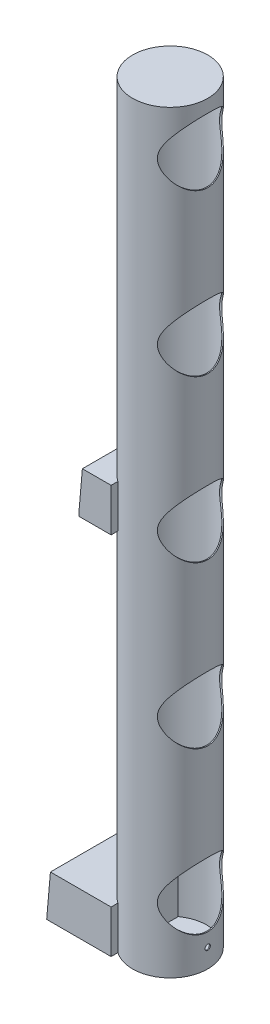
from build123d import *

# Parameters (mm, degrees)
SKETCH_2_R               = 35
SKETCH_2_R_2             = 34
EXTRUDE_1_DEPTH          = 700
EXTRUDE_START            = 1
SKETCH_3_R               = 35
EXTRUDE_2_DEPTH          = 1
SKETCH_4_R               = 35
EXTRUDE_3_DEPTH          = 1
SKETCH_5_R               = 2.5
SKETCH_5_R_2             = 30
CUT_EXTRUDE_1_DEPTH      = 703.745330828
SKETCH_6_R               = 10
CUT_EXTRUDE_2_DEPTH      = 703.745330937
EXTRUDE_START_2          = -20
SKETCH_7_W               = 70
SKETCH_7_H               = 40
EXTRUDE_4_DEPTH          = 60
EXTRUDE_START_3          = -50
SKETCH_8_W               = 70
SKETCH_8_H               = 40
EXTRUDE_5_DEPTH          = 30
CUT_EXTRUDE_3_DEPTH      = 707.417723551
CUT_EXTRUDE_3_DEPTH_BACK = 707.417723551


with BuildPart() as part:
    # Эскиз2 → Бобышка-Вытянуть1 (new body)
    with BuildSketch(Plane(origin=(0, 0, 0), x_dir=(1, 0, 0), z_dir=(0, 1, 0))):
        Circle(SKETCH_2_R)
        Circle(SKETCH_2_R_2, mode=Mode.SUBTRACT)
    extrude(amount=EXTRUDE_1_DEPTH)

    # Эскиз3 → Бобышка-Вытянуть2 (add)
    with BuildSketch(Plane.XZ.offset(EXTRUDE_START)):
        Circle(SKETCH_3_R)
    extrude(amount=-EXTRUDE_2_DEPTH)

    # Эскиз4 → Бобышка-Вытянуть3 (add)
    with BuildSketch(Plane(origin=(0, 700, 0), x_dir=(1, 0, 0), z_dir=(0, 1, 0))):
        Circle(SKETCH_4_R)
    extrude(amount=EXTRUDE_3_DEPTH)

    # Эскиз5 → Вырез-Вытянуть1 (cut, through all)
    with BuildSketch(Plane(origin=(0, 0, 0), x_dir=(0, 0, -1), z_dir=(1, 0, 0))):
        with Locations((0, 16.5)):
            Circle(SKETCH_5_R)
        with Locations((0, 59)):
            Circle(SKETCH_5_R_2)
        with Locations((0, 209)):
            Circle(SKETCH_5_R_2)
        with Locations((0, 359)):
            Circle(SKETCH_5_R_2)
        with Locations((0, 509)):
            Circle(SKETCH_5_R_2)
        with Locations((0, 659)):
            Circle(SKETCH_5_R_2)
    extrude(amount=CUT_EXTRUDE_1_DEPTH, mode=Mode.SUBTRACT)

    # Эскиз6 → Вырез-Вытянуть2 (cut, through all)
    with BuildSketch(Plane(origin=(0, 0, 0), x_dir=(0, 0, -1), z_dir=(1, 0, 0))):
        with Locations((0, 686)):
            Circle(SKETCH_6_R)
    extrude(amount=-CUT_EXTRUDE_2_DEPTH, mode=Mode.SUBTRACT)

    # Эскиз7 → Бобышка-Вытянуть4 (add)
    with BuildSketch(Plane(origin=(0, 0, 0), x_dir=(0, 0, -1), z_dir=(1, 0, 0)).offset(EXTRUDE_START_2)):
        with Locations((0, 19)):
            Rectangle(SKETCH_7_W, SKETCH_7_H)
    extrude(amount=-EXTRUDE_4_DEPTH)

    # Эскиз8 → Бобышка-Вытянуть5 (add)
    with BuildSketch(Plane(origin=(0, 0, 0), x_dir=(0, 0, -1), z_dir=(1, 0, 0)).offset(EXTRUDE_START_3)):
        with Locations((0, 359)):
            Rectangle(SKETCH_8_W, SKETCH_8_H)
    extrude(amount=EXTRUDE_5_DEPTH)

    # Эскиз9 → Вырез-Вытянуть3 (cut, two sides: drawn at the far end of the back side and taken through both)
    with BuildSketch(Plane.XY.offset(-CUT_EXTRUDE_3_DEPTH_BACK)):
        Polygon((-80, -1), (-76.500453459, 39), (-80, 39), align=None)
        Polygon((-50.253854401, 339), (-46.75430786, 379), (-50, 379), align=None)
    extrude(amount=CUT_EXTRUDE_3_DEPTH + CUT_EXTRUDE_3_DEPTH_BACK, mode=Mode.SUBTRACT)


solid = part.part
